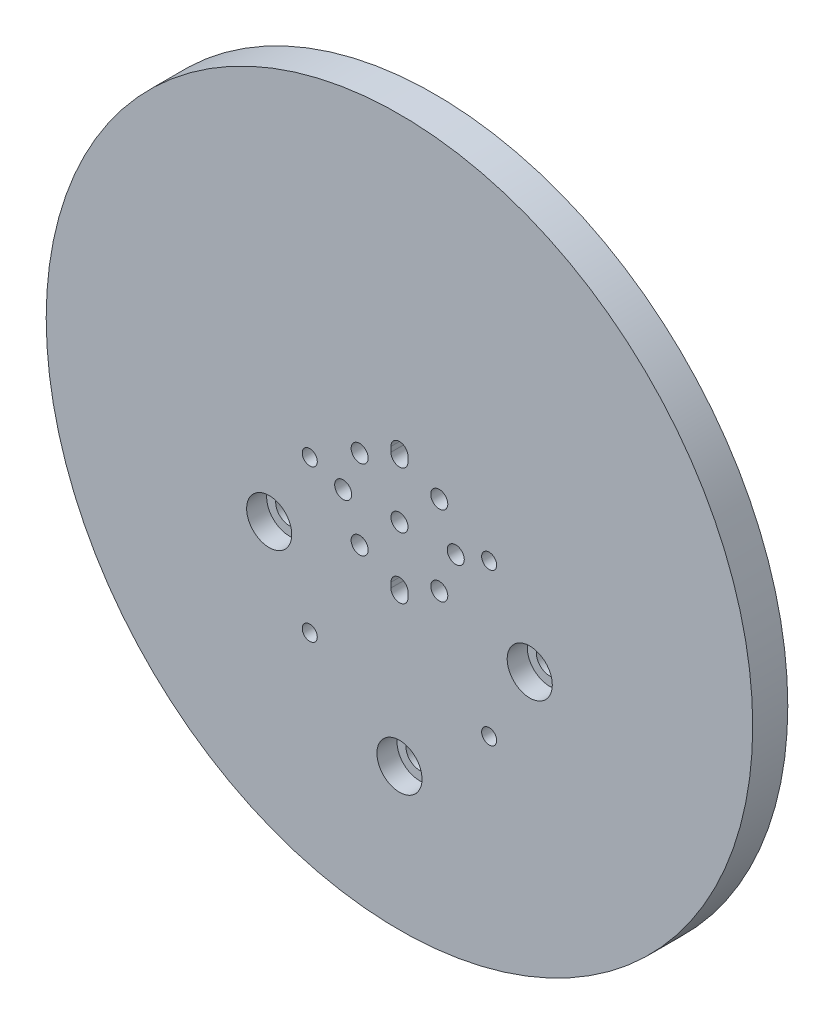
from build123d import *

# Parameters (mm, degrees)
SKETCH1_R           = 65.5
SKETCH1_R_2         = 1.7
BOSS_EXTRUDE1_DEPTH = 7
BOSS_EXTRUDE2_START = -7
SKETCH2_R           = 70.5
SKETCH2_R_2         = 65.5
BOSS_EXTRUDE2_DEPTH = 7
SKETCH5_R           = 2.7
SKETCH5_R_2         = 2.699999999
SKETCH5_R_3         = 1.5
SKETCH5_R_4         = 1.499999999
CUT_EXTRUDE3_DEPTH  = 15
SKETCH6_R           = 4.500000001
CUT_EXTRUDE4_DEPTH  = 4
BOSS_EXTRUDE3_START = -7
SKETCH8_R           = 1.7
BOSS_EXTRUDE3_DEPTH = 7
SKETCH9_R           = 1.7
CUT_EXTRUDE5_DEPTH  = 14
SKETCH10_R          = 2.95
CUT_EXTRUDE6_DEPTH  = 2.5
SKETCH11_R          = 1.7
CUT_EXTRUDE7_DEPTH  = 9.5
SKETCH12_R          = 2.95
CUT_EXTRUDE8_DEPTH  = 2.5
CUT_EXTRUDE9_START  = -7
CUT_EXTRUDE9_DEPTH  = 4.5
CUT_EXTRUDE11_DEPTH = 2.5
SKETCH15_R          = 4.5
CUT_EXTRUDE12_DEPTH = 4
CUT_EXTRUDE13_DEPTH = 2.5


# Read off the part's stored shape, not the designer's step: Cut-Extrude9
with BuildPart() as part:
    # Sketch1 → Boss-Extrude1 (new body)
    with BuildSketch(Plane.XY):
        with Locations((19.5, 0)):
            Circle(SKETCH1_R)
        with Locations((26.5, 0)):
            Circle(SKETCH1_R_2, mode=Mode.SUBTRACT)
        with Locations((19.5, -7)):
            Circle(SKETCH1_R_2, mode=Mode.SUBTRACT)
        with Locations((12.5, 0)):
            Circle(SKETCH1_R_2, mode=Mode.SUBTRACT)
        with Locations((19.5, 7)):
            Circle(SKETCH1_R_2, mode=Mode.SUBTRACT)
    extrude(amount=BOSS_EXTRUDE1_DEPTH)

    # Sketch2 → Boss-Extrude2 (add)
    with BuildSketch(Plane.XY.offset(7).offset(BOSS_EXTRUDE2_START)):
        with Locations((19.5, 0)):
            Circle(SKETCH2_R)
        with Locations((19.5, 0)):
            Circle(SKETCH2_R_2, mode=Mode.SUBTRACT)
    extrude(amount=BOSS_EXTRUDE2_DEPTH)

    # Sketch5 → Cut-Extrude3 (cut)
    with BuildSketch(Plane(origin=(0, 0, 0), x_dir=(-1, 0, 0), z_dir=(0, 0, -1))):
        with Locations((-45.499999999, -12.898668068)):
            Circle(SKETCH5_R)
        with Locations((6.5, -12.898668066)):
            Circle(SKETCH5_R_2)
        with Locations((-19.499999998, -42.185)):
            Circle(SKETCH5_R_2)
        with Locations((-37.4, 2.264186636)):
            Circle(SKETCH5_R_3)
        with Locations((-37.399999999, -28.061522771)):
            Circle(SKETCH5_R_4)
        with Locations((-1.599999999, -28.06152277)):
            Circle(SKETCH5_R_4)
        with Locations((-1.6, 2.264186638)):
            Circle(SKETCH5_R_3)
    extrude(amount=-CUT_EXTRUDE3_DEPTH, mode=Mode.SUBTRACT)

    # Sketch6 → Cut-Extrude4 (cut)
    with BuildSketch(Plane.XY.offset(7)):
        with Locations((19.499999998, -42.185)):
            Circle(SKETCH6_R)
    extrude(amount=-CUT_EXTRUDE4_DEPTH, mode=Mode.SUBTRACT)

    # Sketch8 → Boss-Extrude3 (add)
    with BuildSketch(Plane.XY.offset(7).offset(BOSS_EXTRUDE3_START)):
        with Locations((12.5, 0)):
            Circle(SKETCH8_R)
        with Locations((19.5, -7)):
            Circle(SKETCH8_R)
        with Locations((26.5, 0)):
            Circle(SKETCH8_R)
        with Locations((19.5, 7)):
            Circle(SKETCH8_R)
    extrude(amount=BOSS_EXTRUDE3_DEPTH)

    # Sketch9 → Cut-Extrude5 (cut)
    with BuildSketch(Plane.XY.offset(7)):
        with Locations((19.5, 11.235)):
            Circle(SKETCH9_R)
        with Locations((27.444344687, 7.944344686)):
            Circle(SKETCH9_R)
        with Locations((30.735, -1e-09)):
            Circle(SKETCH9_R)
        with Locations((27.444344686, -7.944344687)):
            Circle(SKETCH9_R)
        with Locations((19.5, -11.235)):
            Circle(SKETCH9_R)
        with Locations((11.555655313, -7.944344687)):
            Circle(SKETCH9_R)
        with Locations((8.265, 0)):
            Circle(SKETCH9_R)
        with Locations((11.555655314, 7.944344686)):
            Circle(SKETCH9_R)
    extrude(amount=-CUT_EXTRUDE5_DEPTH, mode=Mode.SUBTRACT)

    # Sketch10 → Cut-Extrude6 (cut)
    with BuildSketch(Plane(origin=(0, 0, 0), x_dir=(-1, 0, 0), z_dir=(0, 0, -1))):
        with Locations((-19.5, -11.235)):
            Circle(SKETCH10_R)
        with Locations((-27.444344687, -7.944344687)):
            Circle(SKETCH10_R)
        with Locations((-30.735, 0)):
            Circle(SKETCH10_R)
        with Locations((-27.444344687, 7.944344687)):
            Circle(SKETCH10_R)
        with Locations((-19.5, 11.235)):
            Circle(SKETCH10_R)
        with Locations((-11.555655313, 7.944344687)):
            Circle(SKETCH10_R)
        with Locations((-8.265, 0)):
            Circle(SKETCH10_R)
        with Locations((-11.555655313, -7.944344687)):
            Circle(SKETCH10_R)
    extrude(amount=-CUT_EXTRUDE6_DEPTH, mode=Mode.SUBTRACT)

    # Sketch11 → Cut-Extrude7 (cut)
    with BuildSketch(Plane.XY.offset(7)):
        with Locations((19.5, 0)):
            Circle(SKETCH11_R)
    extrude(amount=-CUT_EXTRUDE7_DEPTH, mode=Mode.SUBTRACT)

    # Sketch12 → Cut-Extrude8 (cut)
    with BuildSketch(Plane(origin=(0, 0, 0), x_dir=(-1, 0, 0), z_dir=(0, 0, -1))):
        with Locations((-19.5, 0)):
            Circle(SKETCH12_R)
    extrude(amount=-CUT_EXTRUDE8_DEPTH, mode=Mode.SUBTRACT)

    # Cut-Extrude9 outline → Cut-Extrude9 (cut)
    with BuildSketch(Plane(origin=(0, 0, 0), x_dir=(-1, 0, 0), z_dir=(0, 0, -1)).offset(CUT_EXTRUDE9_START)):
        with BuildLine():
            Line((-21.2, -11.235), (-21.199999984, -12.235))
            ThreePointArc((-21.199999984, -12.235), (-19.499999992, -13.934999993), (-17.8, -12.235))
            Line((-17.8, -12.235), (-17.8, -11.235))
            ThreePointArc((-17.8, -11.235), (-19.5, -12.935), (-21.2, -11.235))
        make_face()
        with BuildLine():
            Line((-21.2, 12.235), (-21.2, 11.235))
            ThreePointArc((-21.2, 11.235), (-19.5, 12.935), (-17.8, 11.235))
            Line((-17.8, 11.235), (-17.8, 12.235))
            ThreePointArc((-17.8, 12.235), (-19.5, 13.935), (-21.2, 12.235))
        make_face()
    extrude(amount=CUT_EXTRUDE9_DEPTH, mode=Mode.SUBTRACT)

    # Sketch14 → Cut-Extrude11 (cut)
    with BuildSketch(Plane(origin=(0, 0, 0), x_dir=(-1, 0, 0), z_dir=(0, 0, -1))):
        with BuildLine():
            Line((-22.45, 11.235), (-22.45, 12.235))
            ThreePointArc((-22.45, 12.235), (-19.5, 15.185), (-16.55, 12.235))
            Line((-16.55, 12.235), (-16.55, 11.235))
            ThreePointArc((-16.55, 11.235), (-19.5, 8.285), (-22.45, 11.235))
        make_face()
        with BuildLine():
            Line((-16.549999992, -11.235), (-16.549999992, -12.235))
            ThreePointArc((-16.549999992, -12.235), (-19.499999992, -15.185000015), (-22.450000007, -12.235))
            Line((-22.450000007, -12.235), (-22.450000007, -11.235))
            ThreePointArc((-22.450000007, -11.235), (-19.5, -8.284999993), (-16.549999992, -11.235))
        make_face()
    extrude(amount=-CUT_EXTRUDE11_DEPTH, mode=Mode.SUBTRACT)

    # Sketch15 → Cut-Extrude12 (cut)
    with BuildSketch(Plane.XY.offset(7)):
        with Locations((45.499999999, -12.898668068)):
            Circle(SKETCH15_R)
        with Locations((-6.5, -12.898668066)):
            Circle(SKETCH15_R)
    extrude(amount=-CUT_EXTRUDE12_DEPTH, mode=Mode.SUBTRACT)

    # Sketch16 → Cut-Extrude13 (cut)
    with BuildSketch(Plane(origin=(0, 0, 0), x_dir=(-1, 0, 0), z_dir=(0, 0, -1))):
        with BuildLine():
            Line((-22.7, 11.235), (-22.7, 12.235))
            ThreePointArc((-22.7, 12.235), (-19.5, 15.435), (-16.3, 12.235))
            Line((-16.3, 12.235), (-16.3, 11.235))
            ThreePointArc((-16.3, 11.235), (-19.5, 8.035), (-22.7, 11.235))
        make_face()
        with BuildLine():
            Line((-16.3, -11.235), (-16.3, -12.235))
            ThreePointArc((-16.3, -12.235), (-19.499999992, -15.435000008), (-22.7, -12.235))
            Line((-22.7, -12.235), (-22.7, -11.235))
            ThreePointArc((-22.7, -11.235), (-19.5, -8.035), (-16.3, -11.235))
        make_face()
    extrude(amount=-CUT_EXTRUDE13_DEPTH, mode=Mode.SUBTRACT)


solid = part.part
